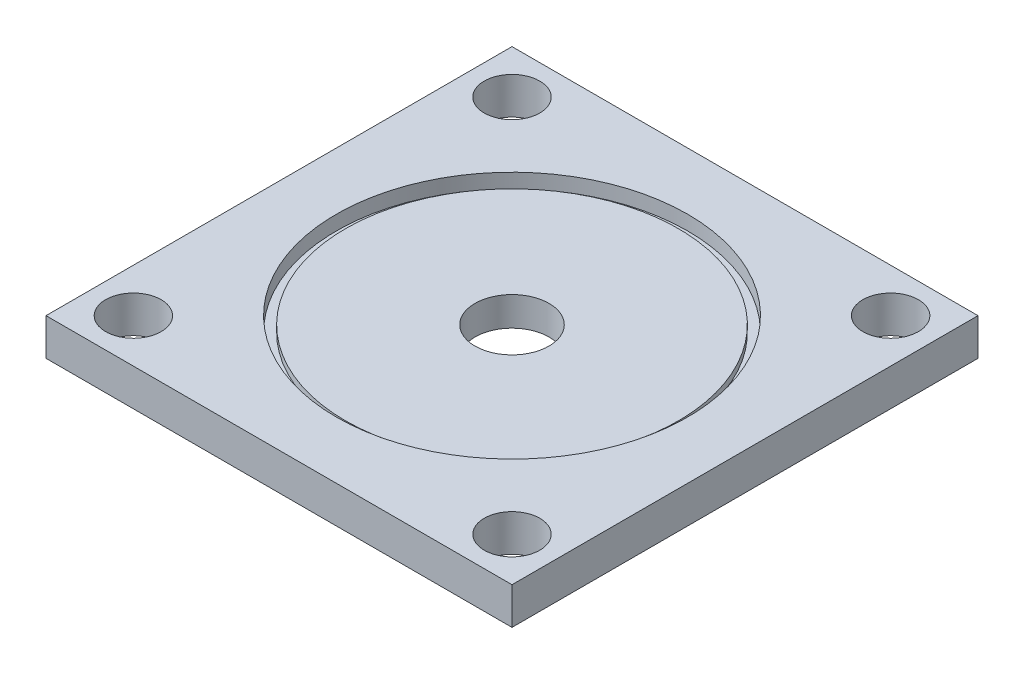
from build123d import *

# Parameters (mm, degrees)
PLATEOUTLINE_W      = 80
PLATEOUTLINE_H      = 80
BOSS_EXTRUDE1_DEPTH = 6.35
RAILGUIDES_R        = 4.7625
CUT_EXTRUDE1_DEPTH  = 10
CUT_EXTRUDE2_START  = 5
FUELGRAINMOUNTING_R = 30.1625
CUT_EXTRUDE2_DEPTH  = 5
GASINTAKE_R         = 6.35
CUT_EXTRUDE3_DEPTH  = 5
CUT_EXTRUDE4_START  = 3.857
SKETCH1_R           = 30.1625
SKETCH1_R_2         = 28.575
CUT_EXTRUDE4_DEPTH  = 1.143


with BuildPart() as part:
    # plateOutline → Boss-Extrude1 (new body)
    with BuildSketch(Plane(origin=(0, 0, 0), x_dir=(1, 0, 0), z_dir=(0, 1, 0))):
        Rectangle(PLATEOUTLINE_W, PLATEOUTLINE_H)
    extrude(amount=BOSS_EXTRUDE1_DEPTH)

    # railGuides → Cut-Extrude1 (cut)
    with BuildSketch(Plane(origin=(0, 0, 0), x_dir=(1, 0, 0), z_dir=(0, 1, 0))):
        with Locations((-32.5, 32.5)):
            Circle(RAILGUIDES_R)
        with Locations((32.5, 32.5)):
            Circle(RAILGUIDES_R)
        with Locations((32.5, -32.5)):
            Circle(RAILGUIDES_R)
        with Locations((-32.5, -32.5)):
            Circle(RAILGUIDES_R)
    extrude(amount=CUT_EXTRUDE1_DEPTH, mode=Mode.SUBTRACT)

    # FuelGrainMounting → Cut-Extrude2 (cut)
    with BuildSketch(Plane(origin=(0, 0, 0), x_dir=(1, 0, 0), z_dir=(0, 1, 0)).offset(CUT_EXTRUDE2_START)):
        Circle(FUELGRAINMOUNTING_R)
    extrude(amount=CUT_EXTRUDE2_DEPTH, mode=Mode.SUBTRACT)

    # GasIntake → Cut-Extrude3 (cut)
    with BuildSketch(Plane(origin=(0, 0, 0), x_dir=(1, 0, 0), z_dir=(0, 1, 0))):
        Circle(GASINTAKE_R)
    extrude(amount=CUT_EXTRUDE3_DEPTH, mode=Mode.SUBTRACT)

    # Sketch1 → Cut-Extrude4 (cut)
    with BuildSketch(Plane(origin=(0, 0, 0), x_dir=(1, 0, 0), z_dir=(0, 1, 0)).offset(CUT_EXTRUDE4_START)):
        Circle(SKETCH1_R)
        Circle(SKETCH1_R_2, mode=Mode.SUBTRACT)
    extrude(amount=CUT_EXTRUDE4_DEPTH, mode=Mode.SUBTRACT)


solid = part.part
